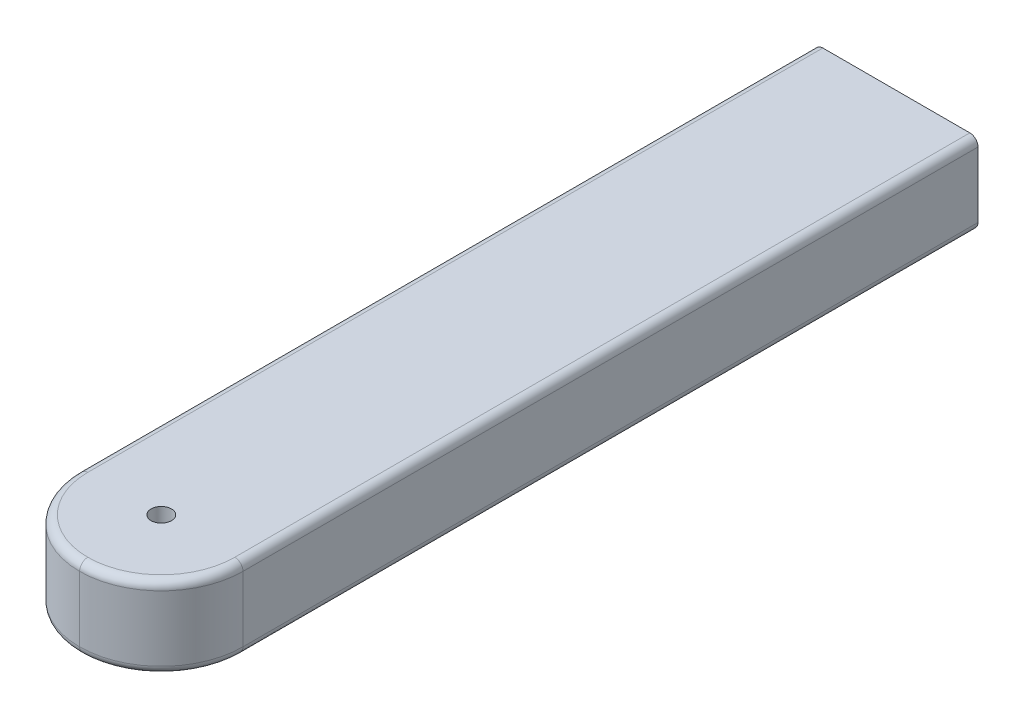
from build123d import *

# Parameters (mm, degrees)
SKETCH1_W               = 50.8
SKETCH1_H               = 25.4
BOSS_EXTRUDE1_DEPTH     = 254
SKETCH2_R               = 3.175
CUT_EXTRUDE1_DEPTH      = 25.4
FILLET2_R               = 25.4
FILLET1_R               = 2.54
CUT_EXTRUDE2_DEPTH      = 261.272549455
CUT_EXTRUDE2_DEPTH_BACK = 261.272549455
SKETCH3_R               = 3.175


with BuildPart() as part:
    # Sketch1 → Boss-Extrude1 (new body)
    with BuildSketch(Plane.XY):
        with Locations((-25.4, 12.7)):
            Rectangle(SKETCH1_W, SKETCH1_H)
    extrude(amount=BOSS_EXTRUDE1_DEPTH)

    # Sketch2 → Cut-Extrude1 (cut)
    with BuildSketch(Plane(origin=(0, 0, 0), x_dir=(-1, 0, 0), z_dir=(0, 0, -1))):
        with Locations((25.4, 12.7)):
            Circle(SKETCH2_R)
    extrude(amount=-CUT_EXTRUDE1_DEPTH, mode=Mode.SUBTRACT)

    # Fillet2
    fillet2_edges = [part.edges().sort_by_distance(p)[0] for p in [
        (0, 12.7, 254),
        (-50.8, 12.7, 254),
    ]]
    fillet(fillet2_edges, radius=FILLET2_R - 0.0001)  # a hair under: the kernel refuses the full size

    # Fillet1
    fillet1_edges = [part.edges().sort_by_distance(p)[0] for p in [
        (-50.8, 25.4, 114.30005),
        (0, 25.4, 114.30005),
        (-43.360541531, 25.4, 246.560541531),
        (-7.439458469, 25.4, 246.560541531),
        (0, 0, 114.30005),
        (-50.8, 0, 114.30005),
        (-43.360541531, 0, 246.560541531),
        (-7.439458469, 0, 246.560541531),
    ]]
    fillet(fillet1_edges, radius=FILLET1_R)

    # Sketch3 → Cut-Extrude2 (cut, two sides: drawn at the far end of the back side and taken through both)
    with BuildSketch(Plane(origin=(0, 25.4, 0), x_dir=(1, 0, 0), z_dir=(0, 1, 0)).offset(-CUT_EXTRUDE2_DEPTH_BACK)):
        with Locations(Location((-25.4, -228.6, 0), (0, 0, 180))):
            Circle(SKETCH3_R)
    extrude(amount=CUT_EXTRUDE2_DEPTH + CUT_EXTRUDE2_DEPTH_BACK, mode=Mode.SUBTRACT)


solid = part.part
